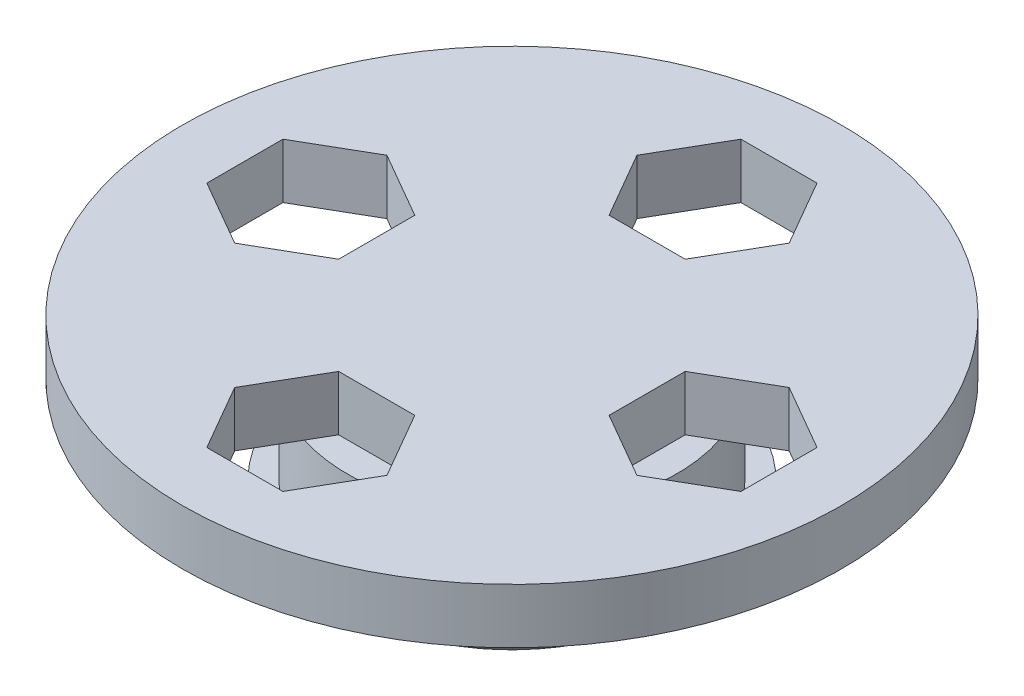
from build123d import *

# Parameters (mm, degrees)
CROQUIS1_R              = 8.5
SALIENTE_EXTRUIR1_DEPTH = 2
CROQUIS2_R              = 7.5
SALIENTE_EXTRUIR2_DEPTH = 4
CROQUIS3_R              = 15
SALIENTE_EXTRUIR3_DEPTH = 2.5
REDONDEO1_R             = 3
CORTAR_EXTRUIR1_DEPTH   = 2.5


with BuildPart() as part:
    # Croquis1 → Saliente-Extruir1 (new body)
    with BuildSketch(Plane(origin=(0, 0, 0), x_dir=(1, 0, 0), z_dir=(0, 1, 0))):
        with Locations(Location((0, 0, 0), (0, 0, 270))):
            Circle(CROQUIS1_R)
    extrude(amount=SALIENTE_EXTRUIR1_DEPTH)

    # Croquis2 → Saliente-Extruir2 (add)
    with BuildSketch(Plane(origin=(0, 2, 0), x_dir=(1, 0, 0), z_dir=(0, 1, 0))):
        with Locations(Location((0, 0, 0), (0, 0, 270))):
            Circle(CROQUIS2_R)
    extrude(amount=SALIENTE_EXTRUIR2_DEPTH)

    # Croquis3 → Saliente-Extruir3 (add)
    with BuildSketch(Plane(origin=(0, 6, 0), x_dir=(1, 0, 0), z_dir=(0, 1, 0))):
        with Locations(Location((0, 0, 0), (0, 0, 270))):
            Circle(CROQUIS3_R)
    extrude(amount=SALIENTE_EXTRUIR3_DEPTH)

    # Redondeo1
    # the kernel refuses this fillet: 3 mm, written as the material it takes off along each edge
    with BuildSketch(Plane(origin=(0, 0, 0), x_dir=(0, 0, 1), z_dir=(-1, 0, 0))) as redondeo1_piece_1:
        with BuildLine():
            CenterArc((5.671572875, 3), REDONDEO1_R, 270, 70.528779366)
            Line((5.671572875, 0), (5.671572875, -0.06))
            Line((5.671572875, -0.06), (8.5, -0.06))
            Line((8.5, -0.06), (8.56, 0))
            ThreePointArc((8.56, 0), (8.56, 1), (8.556568542, 1.98))
            Line((8.556568542, 1.98), (8.5, 2))
        make_face()
    revolve(axis=Axis((0, 0, 0), (0, 1, 0)), mode=Mode.SUBTRACT)

    # Croquis4 → Cortar-Extruir1 (cut)
    with BuildSketch(Plane(origin=(0, 8.5, 0), x_dir=(1, 0, 0), z_dir=(0, 1, 0))):
        Polygon((12.154001459, -1.732050808), (12.154001459, 1.732050808), (9.154001459, 3.464101615), (6.154001459, 1.732050808), (6.154001459, -1.732050808), (9.154001459, -3.464101615), align=None)
        Polygon((3.464101615, 9.154001459), (1.732050808, 12.154001459), (-1.732050808, 12.154001459), (-3.464101615, 9.154001459), (-1.732050808, 6.154001459), (1.732050808, 6.154001459), align=None)
        Polygon((-1.732050808, -12.154001459), (1.732050808, -12.154001459), (3.464101615, -9.154001459), (1.732050808, -6.154001459), (-1.732050808, -6.154001459), (-3.464101615, -9.154001459), align=None)
        Polygon((-12.154001459, 1.732050808), (-12.154001459, -1.732050808), (-9.154001459, -3.464101615), (-6.154001459, -1.732050808), (-6.154001459, 1.732050808), (-9.154001459, 3.464101615), align=None)
    extrude(amount=-CORTAR_EXTRUIR1_DEPTH, mode=Mode.SUBTRACT)


solid = part.part
